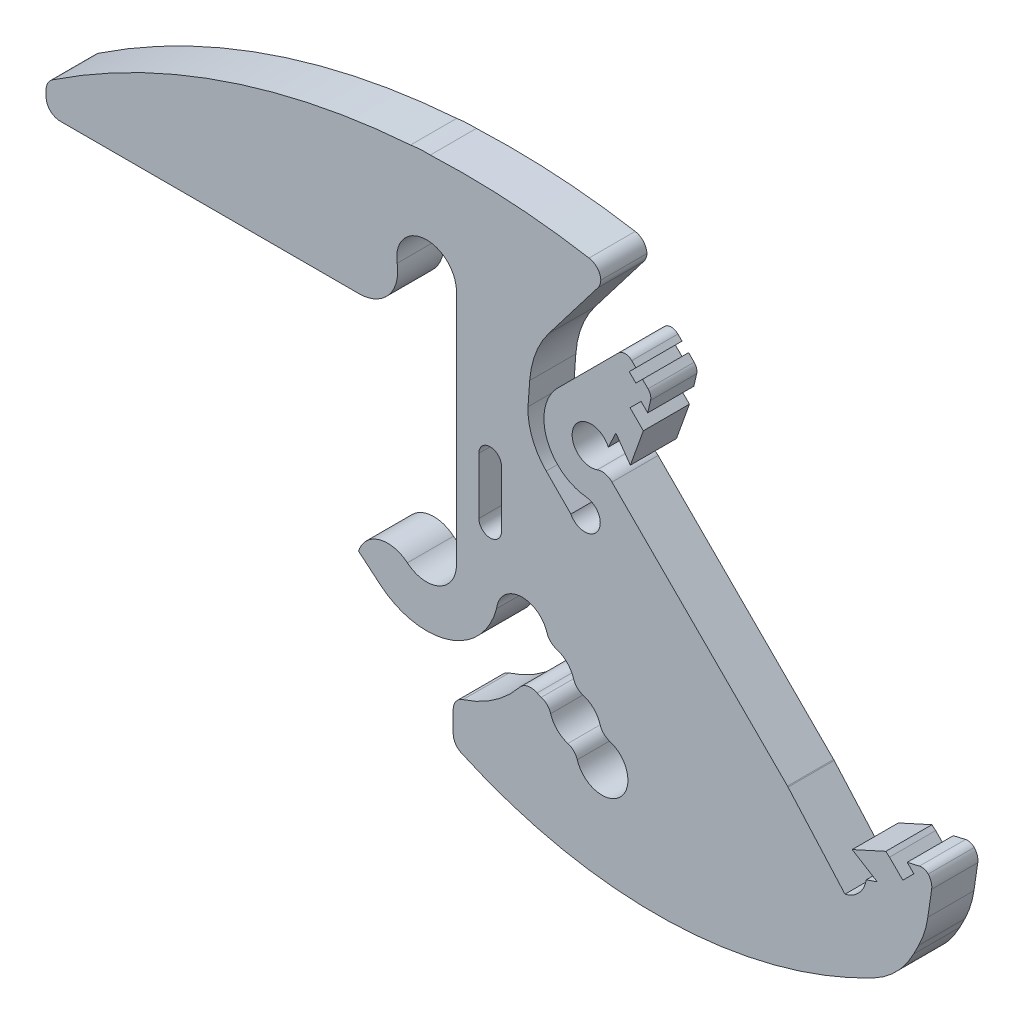
from build123d import *

# Parameters (mm, degrees)
CART_CLIP_DEPTH                    = 4.9022
DEVICE_CLIP_DEPTH                  = 4.9022
JOINT_DEPTH                        = 4.9022
JOINT_FILLETS_R                    = 1
DEVICE_CLIP_FLEX_RELIEF_GEOMETRY_R = 2
DEVICE_CLIP_FLEX_RELIEF_DEPTH      = 62.785838519
SNAP_IN_RELIEF_DEPTH               = 6.35
BOTTOM_BEEFUP_DEPTH                = 4.9022
CABLE_HOLE_R                       = 2.75
CABLE_HOLE_CUT_DEPTH               = 6.35
SHELF_TAIL_DEPTH                   = 4.9022
FRONT_TAB_BEEF_DEPTH               = 4.9022
TOP_CURVE_EXTRUSION_DEPTH          = 4.9022
LPATTERN1_COUNT                    = 4
LPATTERN1_PITCH                    = 4
POSCON_BOTTOM_SNAPBEEF_DEPTH       = 4.9022
POSCON_TOP_CLIP_FLEX_RELIEF_DEPTH  = 6.35
ZIP_TIE_SLOT_DEPTH                 = 6.35
POSCON_BOTTOM_SNAP_RELIEF_DEPTH    = 6.35
SMALL_START                        = -6
SMALL_FILLET_DEPTH                 = 7
POSCON_TOP_SNAP_RELIEF_DEPTH       = 6.35
LARGE_FILLET_R                     = 10


with BuildPart() as part:
    # Cart Clip Geometry → Cart Clip (new body)
    with BuildSketch(Plane.XY):
        with BuildLine():
            Line((11.175, 4.575), (7.675, -8.575))
            Line((7.675, -8.575), (7.675, -12.575))
            ThreePointArc((7.675, -12.575), (3.243595159, -19.530912266), (-4.933394904, -18.454391101))
            Line((-4.933394904, -18.454391101), (-7.231528234, -16.526028272))
            ThreePointArc((-7.231528234, -16.526028272), (-5.042617938, -14.377626523), (-2.040850661, -15.007191107))
            ThreePointArc((-2.040850661, -15.007191107), (1.341812981, -15.452527224), (3.175, -12.575))
            Line((3.175, -12.575), (3.175, 12.575))
            ThreePointArc((3.175, 12.575), (-0.276719483, 15.737918166), (-3.126764616, 12.023667036))
            ThreePointArc((-3.126764616, 12.023667036), (-5.791346514, 7.43274359), (-10.766819067, 9.282405083))
            Line((-10.766819067, 9.282405083), (-11.00522664, 10.634481615))
            ThreePointArc((-11.00522664, 10.634481615), (-0.973965425, 23.707475751), (11.175, 12.575))
            Line((11.175, 12.575), (11.175, 4.575))
        make_face()
    extrude(amount=-CART_CLIP_DEPTH)



with BuildPart() as body_2:
    # Device Clip Geometry → Device Clip (new body)
    with BuildSketch(Plane.XY):
        with BuildLine():
            Line((22.245178849, 15.087875605), (21.538072068, 14.380768824))
            Line((21.538072068, 14.380768824), (22.243106562, 13.67573433))
            Line((22.243106562, 13.67573433), (22.950213344, 14.382841111))
            Line((22.950213344, 14.382841111), (23.537178094, 13.79587636))
            ThreePointArc((23.537178094, 13.79587636), (23.791320059, 13.364452092), (23.804462509, 12.863910072))
            Line((23.804462509, 12.863910072), (23.504826292, 11.565486463))
            Line((23.504826292, 11.565486463), (22.79771951, 12.272593245))
            Line((22.79771951, 12.272593245), (21.623922254, 11.098795988))
            Line((21.623922254, 11.098795988), (23.038135816, 9.684582425))
            Line((23.038135816, 9.684582425), (21.659277593, 5.830850468))
            Line((21.659277593, 5.830850468), (20.24506403, 7.24506403))
            Line((20.24506403, 7.24506403), (18, 5))
            Line((18, 5), (44.516504294, -21.516504294))
            Line((44.516504294, -21.516504294), (46.761568325, -19.271440264))
            Line((46.761568325, -19.271440264), (45.347354762, -17.857226702))
            Line((45.347354762, -17.857226702), (49.20108672, -16.478368479))
            Line((49.20108672, -16.478368479), (50.615300282, -17.892582041))
            Line((50.615300282, -17.892582041), (51.789097539, -16.718784784))
            Line((51.789097539, -16.718784784), (51.081990758, -16.011678003))
            Line((51.081990758, -16.011678003), (52.380414367, -15.712041786))
            ThreePointArc((52.380414367, -15.712041786), (52.880956387, -15.725184235), (53.312380655, -15.9793262))
            Line((53.312380655, -15.9793262), (53.899345406, -16.566290951))
            Line((53.899345406, -16.566290951), (53.192238624, -17.273397732))
            Line((53.192238624, -17.273397732), (53.897273119, -17.978432226))
            Line((53.897273119, -17.978432226), (54.6043799, -17.271325445))
            Line((54.6043799, -17.271325445), (55.041788732, -17.708734278))
            ThreePointArc((55.041788732, -17.708734278), (55.334681951, -18.415841059), (55.041788732, -19.12294784))
            Line((55.041788732, -19.12294784), (48.582368286, -25.582368286))
            ThreePointArc((48.582368286, -25.582368286), (45.04683438, -27.04683438), (41.511300474, -25.582368286))
            Line((41.511300474, -25.582368286), (13.934136008, 1.99479618))
            ThreePointArc((13.934136008, 1.99479618), (12.469669914, 5.530330086), (13.934136008, 9.065863992))
            Line((13.934136008, 9.065863992), (20.393556454, 15.525284438))
            ThreePointArc((20.393556454, 15.525284438), (21.100663236, 15.818177657), (21.807770017, 15.525284438))
            Line((21.807770017, 15.525284438), (22.245178849, 15.087875605))
        make_face()
    extrude(amount=-DEVICE_CLIP_DEPTH)


with BuildPart() as part_1:
    add(part.part)

    add(body_2.part)  # Joint merges body 2
    # Joint Geometry → Joint (add)
    with BuildSketch(Plane.XY):
        Polygon((7.675, -8.575), (41.511300474, -25.582368286), (13.934136008, 1.99479618), (11.175, 4.575), align=None)
    extrude(amount=-JOINT_DEPTH)

    # joint fillets
    # the kernel refuses this fillet: 1 mm, written as the material it adds along each edge
    with BuildSketch(Plane(origin=(7.675, -8.575, 0), x_dir=(0.8934828469815188, -0.44909731924138613, 0), z_dir=(0, 0, -1))) as joint_fillets_piece_1:
        with BuildLine():
            CenterArc((JOINT_FILLETS_R * 1.62185242183, JOINT_FILLETS_R), JOINT_FILLETS_R, 153.314216372, 116.685783628)
            Line((JOINT_FILLETS_R * 0.728369574849, JOINT_FILLETS_R * 1.44909731924), (0, 0))
            Line((0, 0), (JOINT_FILLETS_R * 1.62185242183, 0))
        make_face()
    extrude(amount=4.9022)
    with BuildSketch(Plane(origin=(41.511300474, -25.582368286, 0), x_dir=(-0.8934828469815294, 0.44909731924136537, 0), z_dir=(0, 0, -1))) as joint_fillets_piece_2:
        with BuildLine():
            CenterArc((0.153680417, -1), JOINT_FILLETS_R, 90, 16.706554242)
            ThreePointArc((-0.133789669, -0.042210383), (-0.066746785, -0.02157445), (0, 0))
            Line((0, 0), (0.153680417, 0))
        make_face()
    extrude(amount=4.9022)
    with BuildSketch(Plane(origin=(13.934136008, 1.99479618, 0), x_dir=(-0.7303933527208762, 0.6830267566509803, 0), z_dir=(0, 0, -1))) as joint_fillets_piece_3:
        with BuildLine():
            CenterArc((4.307177284, 1), JOINT_FILLETS_R, 138.225615508, 131.774384492)
            ThreePointArc((3.561403369, 1.66619912), (1.95135729, 0.468333164), (0, 0))
            Line((0, 0), (4.307177284, 0))
        make_face()
    extrude(amount=4.9022)
    with BuildSketch(Plane(origin=(11.175, 4.575, 0), x_dir=(0, 1, 0), z_dir=(0, 0, -1))) as joint_fillets_piece_4:
        with BuildLine():
            CenterArc((JOINT_FILLETS_R * 0.43397607901, JOINT_FILLETS_R), JOINT_FILLETS_R, 223.080619659, 46.919380341)
            Line((-JOINT_FILLETS_R * 0.296417273711, JOINT_FILLETS_R * 0.316973243349), (0, 0))
            Line((0, 0), (JOINT_FILLETS_R * 0.43397607901, 0))
        make_face()
    extrude(amount=4.9022)

    # Device Clip Flex Relief Geometry → Device Clip Flex Relief (cut, through all)
    with BuildSketch(Plane.XY):
        with Locations((17.469669914, 5.530330086)):
            Circle(DEVICE_CLIP_FLEX_RELIEF_GEOMETRY_R)
    extrude(amount=-DEVICE_CLIP_FLEX_RELIEF_DEPTH, mode=Mode.SUBTRACT)

    # Sketch5 → SNAP IN RELIEF (cut)
    with BuildSketch(Plane.XY):
        with BuildLine():
            Line((44.470063399, -22.25362726), (38.389074456, -15.389074456))
            Line((38.389074456, -15.389074456), (46.761568325, -19.271440264))
            ThreePointArc((46.761568325, -19.271440264), (46.141143244, -21.16619399), (44.470063399, -22.25362726))
        make_face()
    extrude(amount=-SNAP_IN_RELIEF_DEPTH, mode=Mode.SUBTRACT)

    # BOTTOM BEEFUP SKETCH → BOTTOM BEEFUP (add)
    with BuildSketch(Plane.XY):
        with BuildLine():
            Line((10.677043667, -13.889484035), (7.526361766, -14.078164518))
            Line((7.526361766, -14.078164518), (7.208614318, -8.772257329))
            Line((7.208614318, -8.772257329), (10.675, -9.282514389))
            Line((10.675, -9.282514389), (44.278748713, -25.488746112))
            Line((44.278748713, -25.488746112), (53.899345406, -16.566290951))
            Line((53.899345406, -16.566290951), (55.041788732, -17.708734278))
            ThreePointArc((55.041788732, -17.708734278), (55.966427661, -19.737585883), (55.333281386, -21.875416975))
            Line((55.333281386, -21.875416975), (50.398436239, -26.810262122))
            ThreePointArc((50.398436239, -26.810262122), (26.922067406, -34.071170743), (2.828292768, -29.238913377))
            Line((2.828292768, -29.238913377), (2.828292768, -24.930419257))
            ThreePointArc((2.828292768, -24.930419257), (8.371790669, -22.091761318), (11.894021473, -16.955397036))
            Line((11.894021473, -16.955397036), (10.677043667, -13.889484035))
        make_face()
    extrude(amount=-BOTTOM_BEEFUP_DEPTH)

    # CABLE HOLE → CABLE HOLE CUT (cut)
    with BuildSketch(Plane.XY):
        with Locations((10.162604388, -14.817796793)):
            Circle(CABLE_HOLE_R)
    cable_hole_cut = extrude(amount=-CABLE_HOLE_CUT_DEPTH, mode=Mode.SUBTRACT)

    # BOX SLIDE BEEF → SHELF TAIL (add)
    with BuildSketch(Plane.XY):
        Polygon((-7.182015159, 7.190807632), (-40.440555285, 7.190807632), (-40.440555285, 10.131018627), (-4.155347731, 22.948702822), align=None)
    extrude(amount=-SHELF_TAIL_DEPTH)

    # BEHIND TOP CLIP BEEF SKETCH → FRONT TAB BEEF (add)
    with BuildSketch(Plane.XY):
        Polygon((18.518382836, 20.841188896), (11.175, 11.254753066), (0.590090247, 23.734409415), (18.518382836, 22.48088631), align=None)
    extrude(amount=-FRONT_TAB_BEEF_DEPTH)

    # TOP CURVE → TOP CURVE EXTRUSION (add)
    with BuildSketch(Plane.XY):
        with BuildLine():
            Line((-40.440555285, 10.131018627), (-38.751141722, 8.751938886))
            Line((-38.751141722, 8.751938886), (0, 16.86846238))
            Line((0, 16.86846238), (13.175622622, 16.86846238))
            Line((13.175622622, 16.86846238), (18.518382836, 22.48088631))
            ThreePointArc((18.518382836, 22.48088631), (-12.184902527, 22.148517873), (-40.440555285, 10.131018627))
        make_face()
    extrude(amount=-TOP_CURVE_EXTRUSION_DEPTH)

    # LPattern1: CABLE HOLE CUT ×4
    with Locations(*[Vector(0.7071067811865482, -0.7071067811865469, 0) * (i * LPATTERN1_PITCH) for i in range(1, LPATTERN1_COUNT)]):
        add(cable_hole_cut, mode=Mode.SUBTRACT)

    # Sketch13 → POSCON BOTTOM SNAPBEEF (add)
    with BuildSketch(Plane.XY):
        Polygon((49.20108672, -16.478368479), (48.811303545, -16.138109098), (45.23751859, -17.761345734), (45.347354762, -17.857226702), align=None)
    extrude(amount=-POSCON_BOTTOM_SNAPBEEF_DEPTH)

    # Sketch14 → POSCON TOP CLIP FLEX RELIEF (cut)
    with BuildSketch(Plane.XY):
        with BuildLine():
            Line((12.714084889, 0.817871011), (15.336641714, -1.828686076))
            ThreePointArc((15.336641714, -1.828686076), (18.169119991, -2.019659869), (16.973164436, 0.555042927))
            ThreePointArc((16.973164436, 0.555042927), (15.318693794, 1.016650685), (13.918068864, 2.010936675))
            ThreePointArc((13.918068864, 2.010936675), (12.824536262, 3.680267019), (12.470969242, 5.644310734))
            Line((12.470969242, 5.644310734), (11.175, 11.254753066))
            Line((11.175, 11.254753066), (10.778900507, 5.767952045))
            ThreePointArc((10.778900507, 5.767952045), (11.234240257, 3.092651589), (12.714084889, 0.817871011))
        make_face()
    extrude(amount=-POSCON_TOP_CLIP_FLEX_RELIEF_DEPTH, mode=Mode.SUBTRACT)

    # Sketch15 → ZIP TIE SLOT (cut)
    with BuildSketch(Plane.XY):
        with BuildLine():
            Line((7.959147306, -1.122008403), (7.959147306, -7.122008403))
            ThreePointArc((7.959147306, -7.122008403), (6.759147306, -8.322008403), (5.559147306, -7.122008403))
            Line((5.559147306, -7.122008403), (5.559147306, -1.122008403))
            ThreePointArc((5.559147306, -1.122008403), (6.759147306, 0.077991597), (7.959147306, -1.122008403))
        make_face()
    extrude(amount=-ZIP_TIE_SLOT_DEPTH, mode=Mode.SUBTRACT)

    # Sketch16 → POSCON BOTTOM SNAP RELIEF (cut)
    with BuildSketch(Plane.XY):
        Polygon((45.23751859, -17.761345734), (47.901521822, -19.397502687), (45.962169994, -20.070838595), align=None)
        Polygon((53.788847446, -16.455792992), (53.040140925, -21.594507061), (50.398436239, -26.810262122), (52.008012569, -28.207638953), (59.817475223, -20.235408925), align=None)
    extrude(amount=-POSCON_BOTTOM_SNAP_RELIEF_DEPTH, mode=Mode.SUBTRACT)

    # SMALL FILLET: read off the stored shape, not the designer's step
    # SMALL FILLET outline → SMALL FILLET (cut)
    with BuildSketch(Plane.XY.offset(SMALL_START)):
        with BuildLine():
            ThreePointArc((12.911452732, -14.897375574), (13.356384308, -14.920601542), (13.791725956, -15.015370746))
            ThreePointArc((13.791725956, -15.015370746), (13.167808208, -14.641020097), (12.793457559, -14.017102349))
            ThreePointArc((12.793457559, -14.017102349), (12.888226764, -14.452443998), (12.911452732, -14.897375574))
        make_face()
        with BuildLine():
            ThreePointArc((15.739879856, -17.725802698), (16.184811432, -17.749028666), (16.620153081, -17.843797871))
            ThreePointArc((16.620153081, -17.843797871), (15.996235332, -17.469447223), (15.621884684, -16.845529474))
            ThreePointArc((15.621884684, -16.845529474), (15.716653888, -17.280871122), (15.739879856, -17.725802698))
        make_face()
        with BuildLine():
            ThreePointArc((18.568306981, -20.554229823), (19.013238557, -20.577455791), (19.448580205, -20.672224996))
            ThreePointArc((19.448580205, -20.672224996), (18.824662457, -20.297874347), (18.450311808, -19.673956599))
            ThreePointArc((18.450311808, -19.673956599), (18.545081013, -20.109298247), (18.568306981, -20.554229823))
        make_face()
        with BuildLine():
            ThreePointArc((15.899037418, -23.223499386), (15.454105842, -23.200273418), (15.018764194, -23.105504213))
            ThreePointArc((15.018764194, -23.105504213), (15.642681942, -23.479854862), (16.017032591, -24.10377261))
            ThreePointArc((16.017032591, -24.10377261), (15.922263386, -23.668430962), (15.899037418, -23.223499386))
        make_face()
        with BuildLine():
            ThreePointArc((13.070610293, -20.395072261), (12.625678717, -20.371846293), (12.190337069, -20.277077088))
            ThreePointArc((12.190337069, -20.277077088), (12.814254818, -20.651427738), (13.188605466, -21.275345486))
            ThreePointArc((13.188605466, -21.275345486), (13.093836261, -20.840003837), (13.070610293, -20.395072261))
        make_face()
        with BuildLine():
            ThreePointArc((10.766719879, -19.263300835), (10.34883576, -19.893280086), (9.89413768, -20.497225986))
            ThreePointArc((9.89413768, -20.497225986), (10.748460388, -19.968555953), (11.744802711, -20.097634486))
            ThreePointArc((11.744802711, -20.097634486), (11.206321204, -19.738425894), (10.766719879, -19.263300835))
        make_face()
        with BuildLine():
            Line((2.828292768, -24.930419257), (2.828292768, -26.073018622))
            ThreePointArc((2.828292768, -26.073018622), (3.116469638, -25.189002389), (3.870272369, -24.644656863))
            ThreePointArc((3.870272369, -24.644656863), (3.352328856, -24.798645783), (2.828292768, -24.930419257))
        make_face()
        with BuildLine():
            ThreePointArc((3.706478432, -29.649302789), (3.066801289, -29.09582405), (2.828292768, -28.284258126))
            Line((2.828292768, -28.284258126), (2.828292768, -29.238913377))
            ThreePointArc((2.828292768, -29.238913377), (3.266388444, -29.446241882), (3.706478432, -29.649302789))
        make_face()
        with BuildLine():
            ThreePointArc((53.312380655, -15.9793262), (53.632233061, -16.547589912), (53.680725913, -17.197880348))
            Line((53.680725913, -17.197880348), (53.788847446, -16.455792992))
            Line((53.788847446, -16.455792992), (53.312380655, -15.9793262))
        make_face()
        with BuildLine():
            ThreePointArc((18.517090684, 21.287433062), (18.42867623, 20.838728265), (18.20916522, 20.437520055))
            Line((18.20916522, 20.437520055), (18.518382836, 20.841188896))
            Line((18.518382836, 20.841188896), (18.518382836, 22.48088631))
            ThreePointArc((18.518382836, 22.48088631), (17.894812545, 22.594883631), (17.270347278, 22.703871827))
            ThreePointArc((17.270347278, 22.703871827), (18.144343786, 22.216251337), (18.517090684, 21.287433062))
        make_face()
        with BuildLine():
            ThreePointArc((-38.940555285, 7.190807632), (-40.001215457, 7.63014746), (-40.440555285, 8.690807632))
            Line((-40.440555285, 8.690807632), (-40.440555285, 7.190807632))
            Line((-40.440555285, 7.190807632), (-38.940555285, 7.190807632))
        make_face()
        with BuildLine():
            ThreePointArc((-40.440555285, 9.332781992), (-40.262919659, 10.040844462), (-39.772085336, 10.581204106))
            ThreePointArc((-39.772085336, 10.581204106), (-40.106894609, 10.356964129), (-40.440555285, 10.131018627))
            Line((-40.440555285, 10.131018627), (-40.440555285, 9.332781992))
        make_face()
        with BuildLine():
            Line((38.389074456, -15.389074456), (38.357004142, -15.357004142))
            ThreePointArc((38.357004142, -15.357004142), (38.388575297, -15.389544316), (38.419148588, -15.423023781))
            Line((38.419148588, -15.423023781), (38.389074456, -15.389074456))
        make_face()
        with BuildLine():
            ThreePointArc((18.141331517, 3.646485429), (18.974552467, 3.696970103), (19.705737892, 3.294262108))
            Line((19.705737892, 3.294262108), (18.883883476, 4.116116524))
            ThreePointArc((18.883883476, 4.116116524), (18.538714881, 3.840021577), (18.141331517, 3.646485429))
        make_face()
    extrude(amount=SMALL_FILLET_DEPTH, mode=Mode.SUBTRACT)

    # Sketch12 → POSCON TOP SNAP RELIEF (cut)
    with BuildSketch(Plane.XY):
        Polygon((21.659277593, 5.830850468), (20.119072518, 8.015253176), (19.31101106, 6.31101106), align=None)
    extrude(amount=-POSCON_TOP_SNAP_RELIEF_DEPTH, mode=Mode.SUBTRACT)

    # LARGE FILLET
    large_fillet_edges = [part_1.edges().sort_by_distance(p)[0] for p in [
        (50.398436239, -26.810262122, -2.4511),
        (11.175, 11.254753066, -2.4511),
        (53.040140925, -21.594507061, -2.4511),
    ]]
    fillet(large_fillet_edges, radius=LARGE_FILLET_R)


solid = part_1.part
